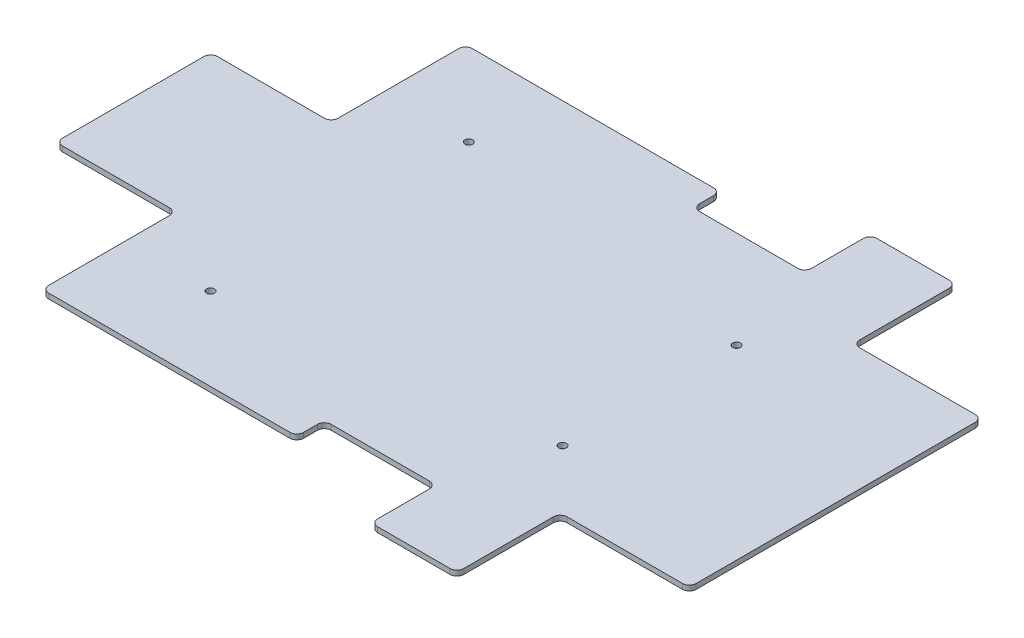
from build123d import *

# Parameters (mm, degrees)
SALIENTE_EXTRUIR1_DEPTH = 3
REDONDEO1_R             = 4
CROQUIS4_R              = 2.25
CORTAR_EXTRUIR1_DEPTH   = 10
CROQUIS5_R              = 2.25
CORTAR_EXTRUIR2_DEPTH   = 10


with BuildPart() as part:
    # Croquis1 → Saliente-Extruir1 (new body)
    with BuildSketch(Plane(origin=(0, 0, 0), x_dir=(1, 0, 0), z_dir=(0, 1, 0))):
        Polygon((0, 0), (-408, 0), (-408, 45), (-338, 45), (-338, 123), (-190, 123), (-190, 107), (-125, 107), (-125, 145), (-75, 145), (-75, 85), (0, 85), align=None)
    saliente_extruir1 = extrude(amount=SALIENTE_EXTRUIR1_DEPTH)

    # Simetría1: Saliente-Extruir1 across plane
    add(saliente_extruir1.mirror(Plane(origin=(0, 3, 0), x_dir=(1, 0, 0), z_dir=(0, 0, -1))))

    # Redondeo1
    redondeo1_edges = [part.edges().sort_by_distance(p)[0] for p in [
        (-408, 1.5, -45),
        (-338, 1.5, -45),
        (-338, 1.5, -123),
        (-190, 1.5, -123),
        (-190, 1.5, -107),
        (-125, 1.5, -107),
        (-125, 1.5, -145),
        (-75, 1.5, -85),
        (-75, 1.5, -145),
        (0, 1.5, -85),
        (0, 1.5, 85),
        (-75, 1.5, 85),
        (-75, 1.5, 145),
        (-125, 1.5, 145),
        (-125, 1.5, 107),
        (-190, 1.5, 107),
        (-190, 1.5, 123),
        (-338, 1.5, 123),
        (-338, 1.5, 45),
        (-408, 1.5, 45),
    ]]
    fillet(redondeo1_edges, radius=REDONDEO1_R)

    # Croquis4 → Cortar-Extruir1 (cut)
    with BuildSketch(Plane(origin=(0, 3, 0), x_dir=(1, 0, 0), z_dir=(0, 1, 0))):
        with Locations((-108.1, -50.5)):
            Circle(CROQUIS4_R)
    cortar_extruir1 = extrude(amount=-CORTAR_EXTRUIR1_DEPTH, mode=Mode.SUBTRACT)

    # Simetría2: Cortar-Extruir1 across plane
    add(cortar_extruir1.mirror(Plane.XY), mode=Mode.SUBTRACT)

    # Croquis5 → Cortar-Extruir2 (cut)
    with BuildSketch(Plane(origin=(0, 3, 0), x_dir=(1, 0, 0), z_dir=(0, 1, 0))):
        with Locations((-288.1, -75)):
            Circle(CROQUIS5_R)
    cortar_extruir2 = extrude(amount=-CORTAR_EXTRUIR2_DEPTH, mode=Mode.SUBTRACT)

    # Simetría3: Cortar-Extruir2 across plane
    add(cortar_extruir2.mirror(Plane.XY), mode=Mode.SUBTRACT)


solid = part.part
